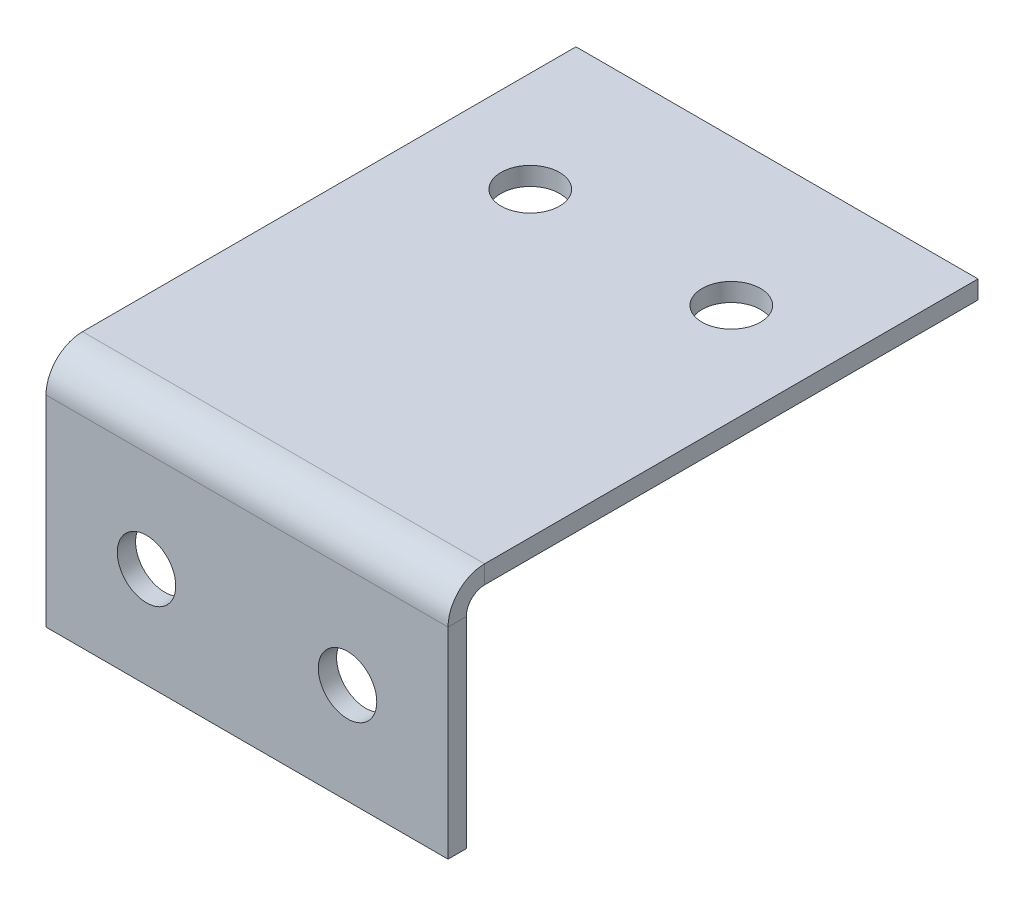
from build123d import *

# Parameters (mm, degrees)
BASE_FLANGE1_DEPTH = 17.4625
SKETCH6_R          = 2.54
CUT_EXTRUDE1_DEPTH = 2.54
SKETCH7_R          = 2.54
CUT_EXTRUDE2_DEPTH = 2.54


# Sheet-metal steps are written as plain solids
with BuildPart() as part:
    # Sketch1 → Base-Flange1 (new, symmetric)
    with BuildSketch(Plane(origin=(0, 0, 0), x_dir=(0, 0, -1), z_dir=(1, 0, 0))):
        with BuildLine():
            Line((0, 0), (0, 17.4625))
            ThreePointArc((0, 17.4625), (0.464967985, 18.585032015), (1.5875, 19.05))
            Line((1.5875, 19.05), (44.45, 19.05))
            Line((44.45, 19.05), (44.45, 20.6375))
            Line((44.45, 20.6375), (1.5875, 20.6375))
            ThreePointArc((1.5875, 20.6375), (-0.65756403, 19.70756403), (-1.5875, 17.4625))
            Line((-1.5875, 17.4625), (-1.5875, 0))
            Line((-1.5875, 0), (0, 0))
        make_face()
    extrude(amount=BASE_FLANGE1_DEPTH, both=True)

    # Sketch6 → Cut-Extrude1 (cut)
    with BuildSketch(Plane.XY.offset(1.5875)):
        with Locations((-8.73125, 8.73125)):
            Circle(SKETCH6_R)
        with Locations((8.73125, 8.73125)):
            Circle(SKETCH6_R)
    extrude(amount=-CUT_EXTRUDE1_DEPTH, mode=Mode.SUBTRACT)

    # Sketch7 → Cut-Extrude2 (cut)
    with BuildSketch(Plane(origin=(0, 20.6375, 0), x_dir=(1, 0, 0), z_dir=(0, 1, 0))):
        with Locations(Location((-8.73125, 31.75, 0), (0, 0, 270))):
            Circle(SKETCH7_R)
        with Locations(Location((8.73125, 31.75, 0), (0, 0, 270))):
            Circle(SKETCH7_R)
    extrude(amount=-CUT_EXTRUDE2_DEPTH, mode=Mode.SUBTRACT)


solid = part.part
